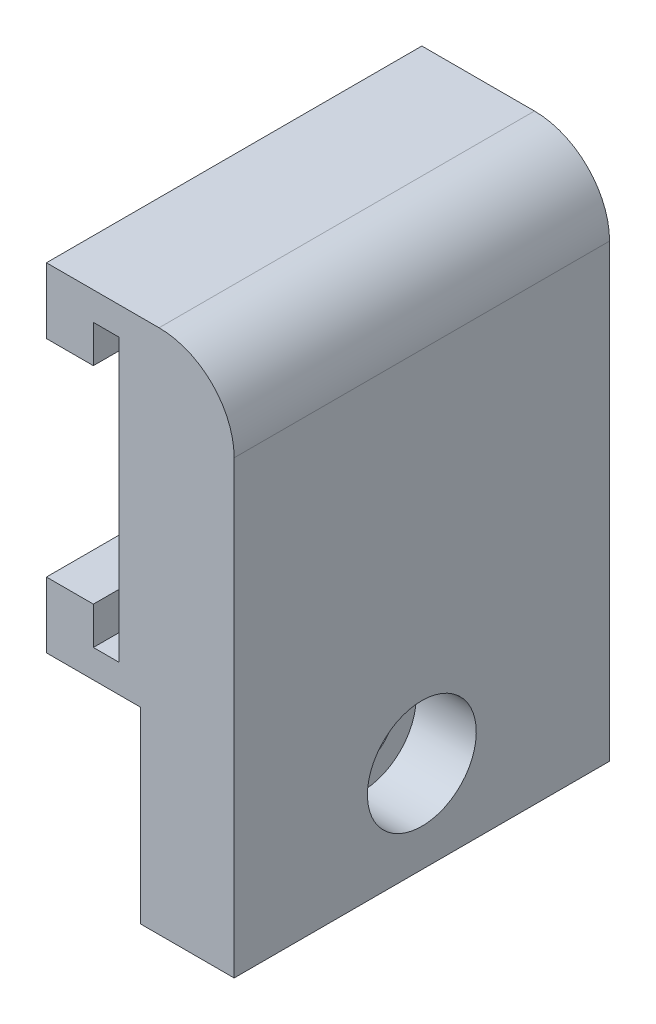
from build123d import *

# Parameters (mm, degrees)
BOSS_EXTRUDE1_DEPTH     = 12.7
CUT_EXTRUDE1_DEPTH      = 27.910817528
CUT_EXTRUDE1_DEPTH_BACK = 27.910817528
SCREWHOLE_R             = 2.159
CUT_EXTRUDE2_START      = -4.064
SKETCH3_R               = 3.683
SKETCH3_R_2             = 2.159
CUT_EXTRUDE2_DEPTH      = 4.064
CUT_EXTRUDE3_DEPTH      = 35.757187746
CUT_EXTRUDE3_DEPTH_BACK = 35.757187746
FILLET3_R               = 5.08


with BuildPart() as part:
    # Profile → Boss-Extrude1 (new, symmetric)
    with BuildSketch(Plane.XY):
        Polygon((6.35, 22.86), (-6.35, 22.86), (-6.35, 0), (0, 0), (0, -12.7), (6.35, -12.7), align=None)
    extrude(amount=BOSS_EXTRUDE1_DEPTH, both=True)

    # ScrewHole → Cut-Extrude1 (cut, two sides: drawn at the far end of the back side and taken through both)
    with BuildSketch(Plane.ZY.offset(-CUT_EXTRUDE1_DEPTH_BACK)):
        with Locations((0, -6.477)):
            Circle(SCREWHOLE_R)
    extrude(amount=CUT_EXTRUDE1_DEPTH + CUT_EXTRUDE1_DEPTH_BACK, mode=Mode.SUBTRACT)

    # Sketch3 → Cut-Extrude2 (cut)
    with BuildSketch(Plane(origin=(6.35, 0, 0), x_dir=(0, 0, -1), z_dir=(1, 0, 0)).offset(CUT_EXTRUDE2_START)):
        with Locations((0, -6.477)):
            Circle(SKETCH3_R)
        with Locations((0, -6.477)):
            Circle(SKETCH3_R_2, mode=Mode.SUBTRACT)
    extrude(amount=CUT_EXTRUDE2_DEPTH, mode=Mode.SUBTRACT)

    # Sketch6 → Cut-Extrude3 (cut, two sides: drawn at the far end of the back side and taken through both)
    with BuildSketch(Plane(origin=(0, 0, -12.7), x_dir=(-1, 0, 0), z_dir=(0, 0, -1)).offset(-CUT_EXTRUDE3_DEPTH_BACK)):
        Polygon((1.4478, 20.955), (3.175, 20.955), (3.175, 18.415), (6.35, 18.415), (7.62, 18.415), (7.62, 4.445), (6.35, 4.445), (3.175, 4.445), (3.175, 1.905), (1.4478, 1.905), align=None)
    extrude(amount=CUT_EXTRUDE3_DEPTH + CUT_EXTRUDE3_DEPTH_BACK, mode=Mode.SUBTRACT)

    # Fillet3
    fillet3_edges = [part.edges().sort_by_distance(p)[0] for p in [
        (6.35, 22.86, 0),
    ]]
    fillet(fillet3_edges, radius=FILLET3_R)


solid = part.part
